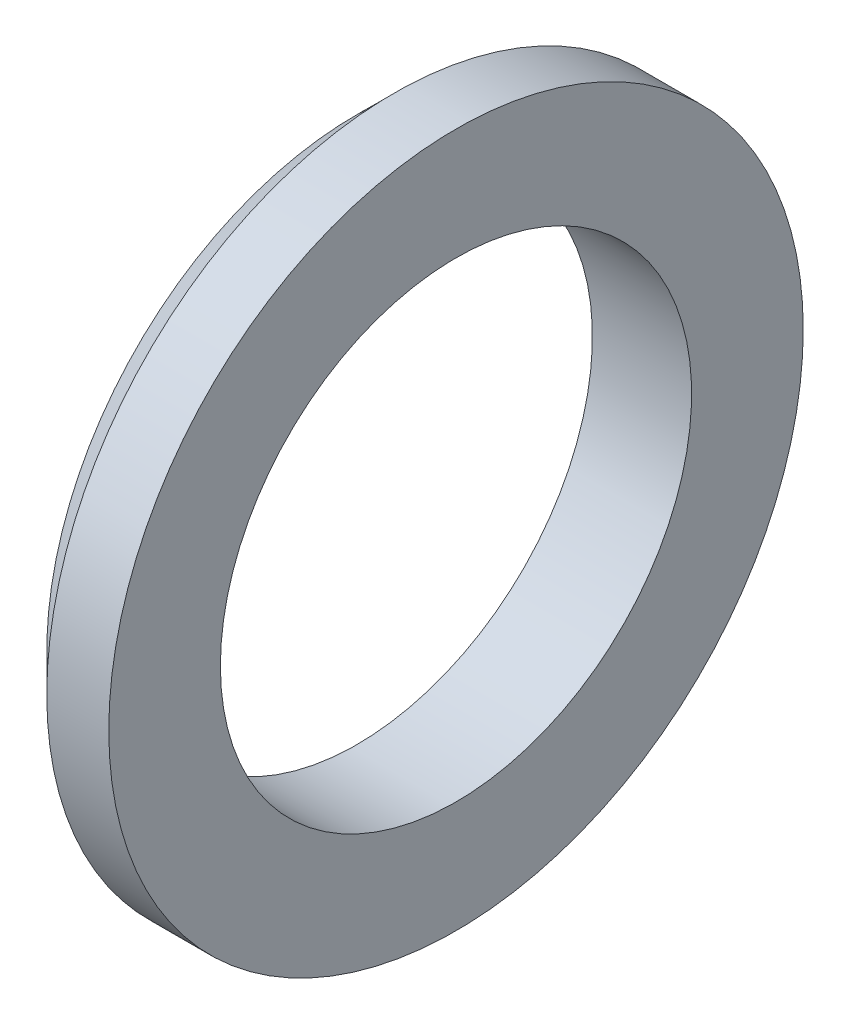
from build123d import *

# Parameters (mm, degrees)
SKETCH_1_W     = 4
SKETCH_1_H     = 4.5
CHAMFER_1_SIZE = 1.5


with BuildPart() as part:
    # 草图1 → 旋转1 (revolve)
    with BuildSketch(Plane.XY):
        with Locations((-2, 11.75)):
            Rectangle(SKETCH_1_W, SKETCH_1_H)
    revolve(axis=Axis((-16.983302851, 0, 0), (1, 0, 0)))

    # 倒角1
    chamfer_1_edges = [part.edges().sort_by_distance(p)[0] for p in [
        (-4, -14, 0),
    ]]
    chamfer(chamfer_1_edges, length=CHAMFER_1_SIZE)


solid = part.part
